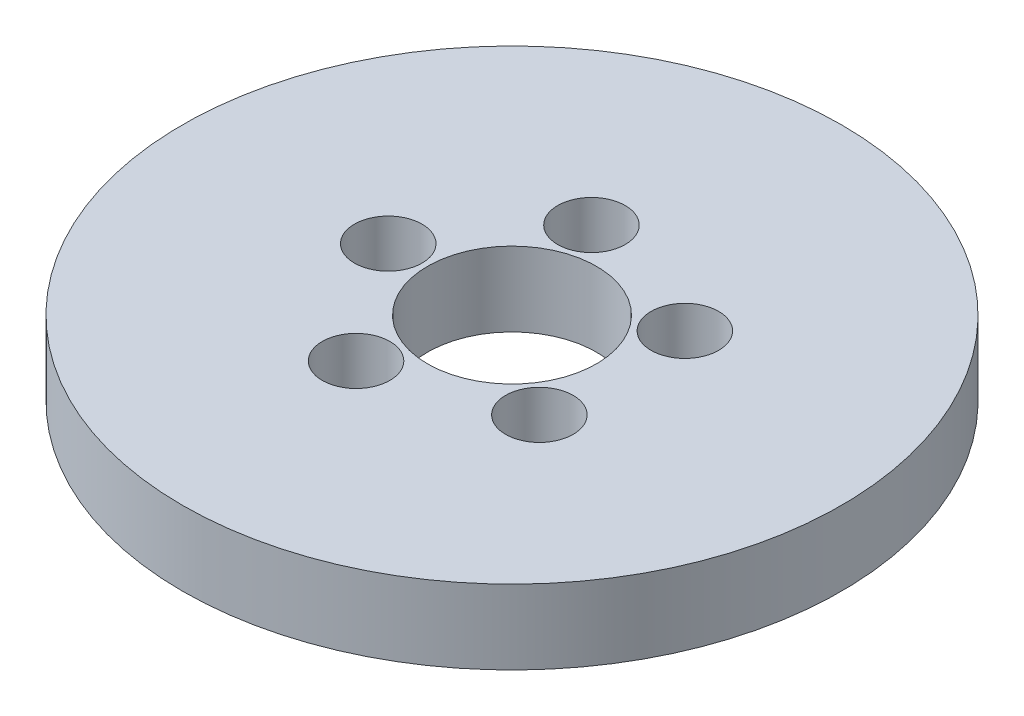
from build123d import *

# Parameters (mm, degrees)
SKETCH1_R           = 97.5
BOSS_EXTRUDE1_DEPTH = 22
SKETCH2_R           = 25
CUT_EXTRUDE1_DEPTH  = 140.629867865
SKETCH3_R           = 10
CUT_EXTRUDE2_DEPTH  = 16.270060169
CIRPATTERN1_COUNT   = 5


with BuildPart() as part:
    # Sketch1 → Boss-Extrude1 (new body)
    with BuildSketch(Plane(origin=(0, 0, 0), x_dir=(1, 0, 0), z_dir=(0, 1, 0))):
        Circle(SKETCH1_R)
    extrude(amount=BOSS_EXTRUDE1_DEPTH)

    # Sketch2 → Cut-Extrude1 (cut, through all)
    with BuildSketch(Plane(origin=(0, 0, 0), x_dir=(1, 0, 0), z_dir=(0, 1, 0))):
        Circle(SKETCH2_R)
    extrude(amount=CUT_EXTRUDE1_DEPTH, mode=Mode.SUBTRACT)

    # Sketch3 → Cut-Extrude2 (cut)
    with BuildSketch(Plane(origin=(0, 22, 0), x_dir=(1, 0, 0), z_dir=(0, 1, 0))):
        with Locations((-36.61453896, 0)):
            Circle(SKETCH3_R)
    cut_extrude2 = extrude(amount=-CUT_EXTRUDE2_DEPTH, mode=Mode.SUBTRACT)

    # CirPattern1: Cut-Extrude2 ×5 about axis
    cirpattern1_axis = Axis((0, 0, 0), (0, 1, 0))
    for i in range(1, CIRPATTERN1_COUNT):
        add(cut_extrude2.rotate(cirpattern1_axis, i * 360 / CIRPATTERN1_COUNT), mode=Mode.SUBTRACT)


solid = part.part
